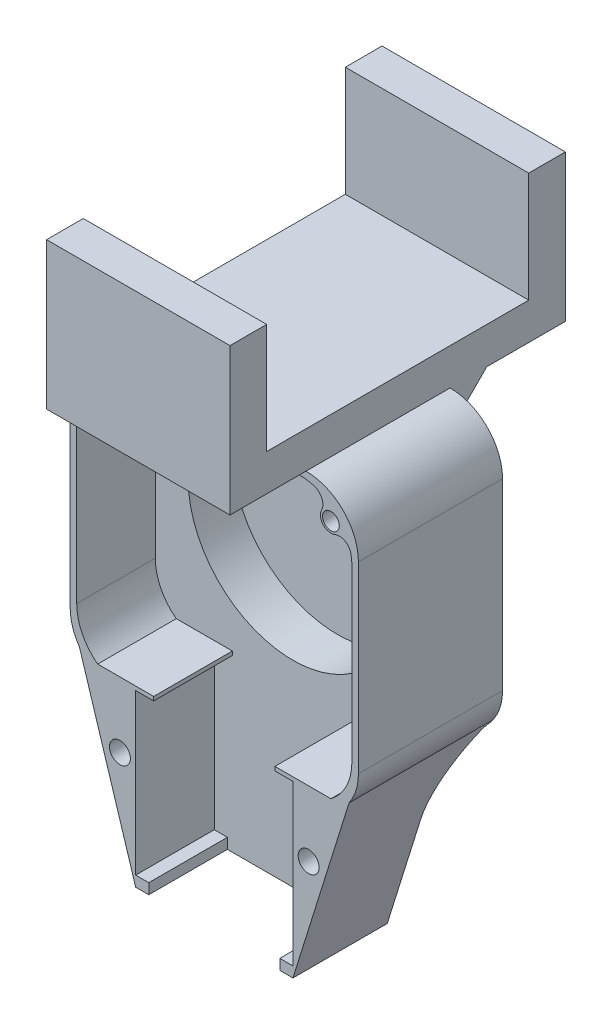
from build123d import *

# Parameters (mm, degrees)
CROQUIS4_R                  = 2.5
SALIENTE_EXTRUIR1_DEPTH     = 4
CROQUIS5_R                  = 20
SALIENTE_EXTRUIR2_DEPTH     = 8.5
SALIENTE_EXTRUIR4_START     = -3
SALIENTE_EXTRUIR4_DEPTH     = 3
REDONDEO1_R                 = 10
SALIENTE_EXTRUIR5_OUTLINE_R = 2
SALIENTE_EXTRUIR5_DEPTH     = 15
CROQUIS9_R                  = 1.6
CORTAR_EXTRUIR1_DEPTH       = 70.417217007
CROQUIS11_W                 = 35
CROQUIS11_H                 = 50
SALIENTE_EXTRUIR7_DEPTH     = 7
CROQUIS12_W                 = 35
CROQUIS12_H                 = 7
SALIENTE_EXTRUIR8_DEPTH     = 28
CHAFL_N2_SIZE               = 7
CROQUIS13_R                 = 11.05
CORTAR_EXTRUIR2_DEPTH       = 2


# Read off the part's stored shape, not the designer's step: Saliente-Extruir5
with BuildPart() as part:
    # Croquis4 → Saliente-Extruir1 (new body)
    with BuildSketch(Plane.XY):
        with BuildLine():
            Line((-17.5, 27.5), (17.5, 27.5))
            ThreePointArc((17.5, 27.5), (24.571067812, 24.571067812), (27.5, 17.5))
            Line((27.5, 17.5), (27.5, -17.5))
            ThreePointArc((27.5, -17.5), (24.571067812, -24.571067812), (17.5, -27.5))
            Line((17.5, -27.5), (-17.5, -27.5))
            ThreePointArc((-17.5, -27.5), (-24.571067812, -24.571067812), (-27.5, -17.5))
            Line((-27.5, -17.5), (-27.5, 17.5))
            ThreePointArc((-27.5, 17.5), (-24.571067812, 24.571067812), (-17.5, 27.5))
        make_face()
        Circle(CROQUIS4_R, mode=Mode.SUBTRACT)
    extrude(amount=SALIENTE_EXTRUIR1_DEPTH)

    # Croquis5 → Saliente-Extruir2 (add)
    with BuildSketch(Plane.XY.offset(4)):
        with BuildLine():
            Line((-17.5, 27.5), (17.5, 27.5))
            ThreePointArc((17.5, 27.5), (24.571067812, 24.571067812), (27.5, 17.5))
            Line((27.5, 17.5), (27.5, -17.5))
            ThreePointArc((27.5, -17.5), (24.571067812, -24.571067812), (17.5, -27.5))
            Line((17.5, -27.5), (-17.5, -27.5))
            ThreePointArc((-17.5, -27.5), (-24.571067812, -24.571067812), (-27.5, -17.5))
            Line((-27.5, -17.5), (-27.5, 17.5))
            ThreePointArc((-27.5, 17.5), (-24.571067812, 24.571067812), (-17.5, 27.5))
        make_face()
        Circle(CROQUIS5_R, mode=Mode.SUBTRACT)
    extrude(amount=SALIENTE_EXTRUIR2_DEPTH)

    # Croquis6 → Saliente-Extruir4 (add)
    with BuildSketch(Plane.XY.offset(12.5).offset(SALIENTE_EXTRUIR4_START)):
        with BuildLine():
            Line((-25.720640569, -23.193950178), (-15, -57.5))
            Line((-15, -57.5), (15, -57.5))
            Line((15, -57.5), (25.720640569, -23.193950178))
            ThreePointArc((25.720640569, -23.193950178), (22.140069947, -26.358315353), (17.5, -27.5))
            Line((17.5, -27.5), (-17.5, -27.5))
            ThreePointArc((-17.5, -27.5), (-22.140069947, -26.358315353), (-25.720640569, -23.193950178))
        make_face()
    extrude(amount=SALIENTE_EXTRUIR4_DEPTH)

    # Redondeo1
    # the kernel refuses this fillet: 10 mm, written as the material it adds along each edge
    with BuildSketch(Plane(origin=(17.5, -17.5, 9.5), x_dir=(-0.31521717271258337, 0.949019564617656, 0), z_dir=(-0.949019564617656, -0.31521717271258337, 0))) as redondeo1_piece_1_section:
        with BuildLine():
            CenterArc((19.987492178, 10), REDONDEO1_R, 182.865983983, 87.134016017)
            Line((19.987492178, 0), (10, 0))
            Line((10, 0), (10, 9.5))
        make_face()
    redondeo1_piece_1 = revolve(axis=Axis((17.5, -17.5, 9.5), (0, 0, -1)), revolution_arc=198.373924806, mode=Mode.PRIVATE)
    redondeo1_piece_1 = split(redondeo1_piece_1, bisect_by=Plane(origin=(27.5, -26.624186886, 2.060383814), z_dir=(-1, 0, 0)), keep=Keep.TOP, mode=Mode.PRIVATE)
    redondeo1_piece_1 = redondeo1_piece_1 - Plane(origin=(0, 0, 2.060383814), x_dir=(1, 0, 0), z_dir=(0, 0, -1)) * Cylinder(20, 80, mode=Mode.PRIVATE)
    redondeo1_piece_1 = split(redondeo1_piece_1, bisect_by=Plane(origin=(24.437894836, -27.298736526, 2.060383814), z_dir=(-0.9544799780350299, 0.2982749931359464, 0)), keep=Keep.TOP, mode=Mode.PRIVATE)
    add(redondeo1_piece_1)
    with BuildSketch(Plane(origin=(-17.5, -17.5, 9.5), x_dir=(0, -1, 0), z_dir=(1, 0, 0))) as redondeo1_piece_2_section:
        with BuildLine():
            CenterArc((19.987492178, 10), REDONDEO1_R, 182.865983983, 87.134016017)
            Line((19.987492178, 0), (10, 0))
            Line((10, 0), (10, 9.5))
        make_face()
    redondeo1_piece_2 = revolve(axis=Axis((-17.5, -17.5, 9.5), (0, 0, -1)), revolution_arc=198.373924806, mode=Mode.PRIVATE)
    redondeo1_piece_2 = split(redondeo1_piece_2, bisect_by=Plane(origin=(-27.5, -26.624186886, 2.060383814), z_dir=(1, 0, 0)), keep=Keep.TOP, mode=Mode.PRIVATE)
    redondeo1_piece_2 = redondeo1_piece_2 - Plane(origin=(0, 0, 2.060383814), x_dir=(1, 0, 0), z_dir=(0, 0, -1)) * Cylinder(20, 80, mode=Mode.PRIVATE)
    redondeo1_piece_2 = split(redondeo1_piece_2, bisect_by=Plane(origin=(-24.437894836, -27.298736526, 2.060383814), z_dir=(0.9544799780350299, 0.29827499313594635, 0)), keep=Keep.TOP, mode=Mode.PRIVATE)
    add(redondeo1_piece_2)
    with BuildSketch(Plane(origin=(17.5, -27.5, 9.5), x_dir=(0, 0, -1), z_dir=(-1, 0, 0))) as redondeo1_piece_3:
        with BuildLine():
            CenterArc((10, 9.987492178), REDONDEO1_R, 180, 87.134016017)
            Line((0, 9.987492178), (0, 0))
            Line((0, 0), (9.5, 0))
        make_face()
    extrude(amount=35)

    # Saliente-Extruir5 outline → Saliente-Extruir5 (add)
    with BuildSketch(Plane.XY.offset(12.5)):
        with BuildLine():
            ThreePointArc((-27.5, -17.5), (-27.04479978, -20.482749931), (-25.720640569, -23.193950178))
            Line((-25.720640569, -23.193950178), (-15, -57.5))
            Line((-15, -57.5), (-12.5, -57.5))
            Line((-12.5, -57.5), (-12.5, -55.5))
            Line((-12.5, -55.5), (-15, -55.5))
            Line((-15, -55.5), (-15, -25))
            Line((-15, -25), (-11.560632513, -25))
            Line((-11.560632513, -25), (-11.560632513, -24.25))
            Line((-11.560632513, -24.25), (-22.25, -24.25))
            ThreePointArc((-22.25, -24.25), (-25.19427191, -20.722135955), (-26.25, -16.25))
            Line((-26.25, -16.25), (-26.25, 16.25))
            ThreePointArc((-26.25, 16.25), (-26.205571214, 17.191595354), (-26.072679638, 18.12482392))
            ThreePointArc((-26.072679638, 18.12482392), (-24.934779512, 19.680078923), (-23.010409798, 19.782235789))
            ThreePointArc((-23.010409798, 19.782235789), (-20.782444846, 20.273260806), (-20.464111601, 22.532375088))
            ThreePointArc((-20.464111601, 22.532375088), (-20.519074057, 24.539569231), (-19.008189542, 25.862096049))
            ThreePointArc((-19.008189542, 25.862096049), (-17.64266642, 26.152549179), (-16.25, 26.25))
            Line((-16.25, 26.25), (16.25, 26.25))
            ThreePointArc((16.25, 26.25), (17.64266642, 26.152549179), (19.008189542, 25.862096049))
            ThreePointArc((19.008189542, 25.862096049), (20.519074057, 24.539569231), (20.464111601, 22.532375088))
            ThreePointArc((20.464111601, 22.532375088), (20.782444846, 20.273260806), (23.010409798, 19.782235789))
            ThreePointArc((23.010409798, 19.782235789), (24.934779512, 19.680078923), (26.072679638, 18.12482392))
            ThreePointArc((26.072679638, 18.12482392), (26.205571214, 17.191595354), (26.25, 16.25))
            Line((26.25, 16.25), (26.25, -16.25))
            ThreePointArc((26.25, -16.25), (25.19427191, -20.722135955), (22.25, -24.25))
            Line((22.25, -24.25), (11.560632513, -24.25))
            Line((11.560632513, -24.25), (11.560632513, -25))
            Line((11.560632513, -25), (15, -25))
            Line((15, -25), (15, -55.5))
            Line((15, -55.5), (12.5, -55.5))
            Line((12.5, -55.5), (12.5, -57.5))
            Line((12.5, -57.5), (15, -57.5))
            Line((15, -57.5), (25.720640569, -23.193950178))
            ThreePointArc((25.720640569, -23.193950178), (27.04479978, -20.482749931), (27.5, -17.5))
            Line((27.5, -17.5), (27.5, 17.5))
            ThreePointArc((27.5, 17.5), (24.571067812, 24.571067812), (17.5, 27.5))
            Line((17.5, 27.5), (-17.5, 27.5))
            ThreePointArc((-17.5, 27.5), (-24.571067812, 24.571067812), (-27.5, 17.5))
            Line((-27.5, 17.5), (-27.5, -17.5))
        make_face()
        with Locations((-18, -36.75)):
            Circle(SALIENTE_EXTRUIR5_OUTLINE_R, mode=Mode.SUBTRACT)
        with Locations((18, -36.75)):
            Circle(SALIENTE_EXTRUIR5_OUTLINE_R, mode=Mode.SUBTRACT)
    extrude(amount=SALIENTE_EXTRUIR5_DEPTH)

    # Croquis9 → Cortar-Extruir1 (cut, through all)
    with BuildSketch(Plane.XY.offset(27.5)):
        with Locations((-22.25, 21.632040357)):
            Circle(CROQUIS9_R)
        with Locations((-18, -36.75)):
            Circle(CROQUIS9_R)
        with Locations((18, -36.75)):
            Circle(CROQUIS9_R)
        with Locations((22.25, 21.632040357)):
            Circle(CROQUIS9_R)
    extrude(amount=-CORTAR_EXTRUIR1_DEPTH, mode=Mode.SUBTRACT)

    # Croquis11 → Saliente-Extruir7 (add)
    with BuildSketch(Plane(origin=(0, 27.5, 0), x_dir=(1, 0, 0), z_dir=(0, 1, 0))):
        with Locations((0, -10)):
            Rectangle(CROQUIS11_W, CROQUIS11_H)
    extrude(amount=SALIENTE_EXTRUIR7_DEPTH)

    # Croquis12 → Saliente-Extruir8 (add)
    with BuildSketch(Plane.XZ.offset(-27.5)):
        with Locations((0, 38.5)):
            Rectangle(CROQUIS12_W, CROQUIS12_H)
        with Locations((0, -18.5)):
            Rectangle(CROQUIS12_W, CROQUIS12_H)
    extrude(amount=-SALIENTE_EXTRUIR8_DEPTH)

    # Chaflán2
    chafl_n2_edges = [part.edges().sort_by_distance(p)[0] for p in [
        (0, 27.5, 0),
    ]]
    chamfer(chafl_n2_edges, length=CHAFL_N2_SIZE)

    # Croquis13 → Cortar-Extruir2 (cut)
    with BuildSketch(Plane(origin=(0, 0, 0), x_dir=(-1, 0, 0), z_dir=(0, 0, -1))):
        Circle(CROQUIS13_R)
    extrude(amount=-CORTAR_EXTRUIR2_DEPTH, mode=Mode.SUBTRACT)


solid = part.part
